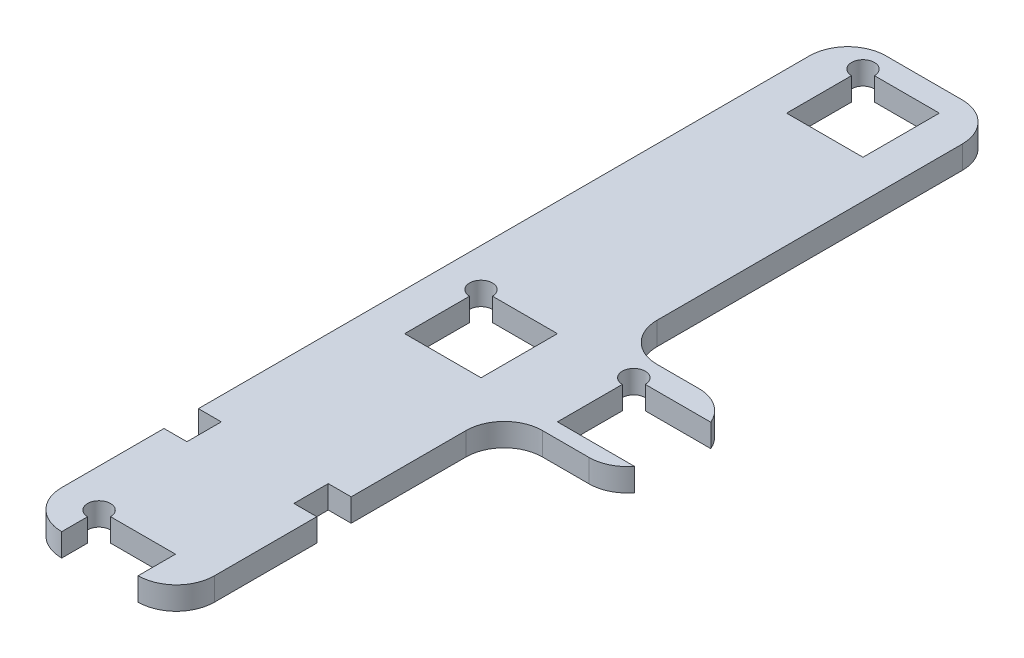
from build123d import *

# Parameters (mm, degrees)
SKETCH1_R           = 1.5
SKETCH1_W           = 20
SKETCH1_H           = 5
BOSS_EXTRUDE3_DEPTH = 3
FILLET2_R           = 5
CUT_EXTRUDE1_REACH  = 74.753
SKETCH3_W           = 28.786192162
SKETCH3_H           = 21.000620262
FILLET3_R           = 5
SKETCH5_W           = 10
SKETCH5_H           = 10
CUT_EXTRUDE2_DEPTH  = 10
BOSS_EXTRUDE5_START = -3
SKETCH8_W           = 35
SKETCH8_H           = 15
SKETCH8_R           = 1.5
BOSS_EXTRUDE5_DEPTH = 3
CUT_EXTRUDE3_REACH  = 62.523
SKETCH9_W           = 10
SKETCH9_H           = 10
SKETCH9_W_2         = 11
FILLET4_R           = 5


with BuildPart() as part:
    # Sketch1 → Boss-Extrude3 (new body)
    # profile 1 of 3: a face of its own
    with BuildSketch(Plane(origin=(0, 0, 0), x_dir=(1, 0, 0), z_dir=(0, 1, 0))):
        Polygon((10, 55), (-10, 55), (-10, -30), (-7, -30), (-7, -34.5), (-10, -34.5), (-10, -50), (10, -50), (10, -34.5), (7, -34.5), (7, -30), (10, -30), align=None)
        with Locations(Location((-5, -48, 0), (0, 0, 270))):
            Circle(SKETCH1_R, mode=Mode.SUBTRACT)
        with Locations(Location((-5, 2, 0), (0, 0, 270))):
            Circle(SKETCH1_R, mode=Mode.SUBTRACT)
        with Locations(Location((-5, 52, 0), (0, 0, 270))):
            Circle(SKETCH1_R, mode=Mode.SUBTRACT)
    # profile 2 of 3: a face of its own
    with BuildSketch(Plane(origin=(0, 0, 0), x_dir=(1, 0, 0), z_dir=(0, 1, 0))):
        Polygon((10, -55), (-10, -55), (-10, -64.5), (-7, -64.5), (-7, -69), (-10, -69), (-10, -72), (10, -72), (10, -69), (7, -69), (7, -64.5), (10, -64.5), align=None)
    # profile 3 of 3: a face of its own
    with BuildSketch(Plane(origin=(0, 0, 0), x_dir=(1, 0, 0), z_dir=(0, 1, 0))):
        with Locations((0, -52.5)):
            Rectangle(SKETCH1_W, SKETCH1_H)
    extrude(amount=BOSS_EXTRUDE3_DEPTH)

    # Fillet2
    # the kernel refuses this fillet: 5 mm, written as the material it takes off along each edge
    with BuildSketch(Plane(origin=(10, -11.456439237, 72), x_dir=(0, 0, -1), z_dir=(0, 1, 0))) as fillet2_piece_1:
        with BuildLine():
            CenterArc((5, 4.582575695), FILLET2_R, 180, 66.421821522)
            Line((0, 4.582575695), (-0.1, 4.582575695))
            Line((-0.1, 4.582575695), (-0.1, 0))
            Line((-0.1, 0), (0, -0.1))
            ThreePointArc((0, -0.1), (1.5, -0.1), (2.96, -0.091651514))
            Line((2.96, -0.091651514), (3, 0))
        make_face()
    extrude(amount=25.912878475, mode=Mode.SUBTRACT)
    with BuildSketch(Plane(origin=(-10, -11.456439237, 72), x_dir=(1, 0, 0), z_dir=(0, 1, 0))) as fillet2_piece_2:
        with BuildLine():
            CenterArc((4.582575695, 5), FILLET2_R, 203.578178478, 66.421821522)
            Line((0, 3), (-0.091651514, 2.96))
            ThreePointArc((-0.091651514, 2.96), (-0.1, 1.5), (-0.1, 0))
            Line((-0.1, 0), (0, -0.1))
            Line((0, -0.1), (4.582575695, -0.1))
            Line((4.582575695, -0.1), (4.582575695, 0))
        make_face()
    extrude(amount=25.912878475, mode=Mode.SUBTRACT)
    with BuildSketch(Plane(origin=(-10, -12.5, -55), x_dir=(0, 0, 1), z_dir=(0, 1, 0))) as fillet2_piece_3:
        with BuildLine():
            CenterArc((FILLET2_R, FILLET2_R), FILLET2_R, 180, 90)
            Line((0, FILLET2_R), (-FILLET2_R * 0.02, FILLET2_R))
            Line((-FILLET2_R * 0.02, FILLET2_R), (-FILLET2_R * 0.02, -FILLET2_R * 0.02))
            Line((-FILLET2_R * 0.02, -FILLET2_R * 0.02), (FILLET2_R, -FILLET2_R * 0.02))
            Line((FILLET2_R, -FILLET2_R * 0.02), (FILLET2_R, 0))
        make_face()
    extrude(amount=28, mode=Mode.SUBTRACT)
    with BuildSketch(Plane(origin=(10, -12.5, -55), x_dir=(0, 0, 1), z_dir=(0, 1, 0))) as fillet2_piece_4:
        with BuildLine():
            CenterArc((FILLET2_R, -FILLET2_R), FILLET2_R, 90, 90)
            Line((0, -FILLET2_R), (-FILLET2_R * 0.02, -FILLET2_R))
            Line((-FILLET2_R * 0.02, -FILLET2_R), (-FILLET2_R * 0.02, FILLET2_R * 0.02))
            Line((-FILLET2_R * 0.02, FILLET2_R * 0.02), (FILLET2_R, FILLET2_R * 0.02))
            Line((FILLET2_R, FILLET2_R * 0.02), (FILLET2_R, 0))
        make_face()
    extrude(amount=28, mode=Mode.SUBTRACT)

    # Sketch3 → Cut-Extrude1 (cut, up to next)
    with BuildSketch(Plane(origin=(0, 3, 0), x_dir=(1, 0, 0), z_dir=(0, 1, 0)), mode=Mode.PRIVATE) as cut_extrude1_sk1:
        with Locations((0, -63.390803798)):
            Rectangle(SKETCH3_W, SKETCH3_H)
    cut_extrude1_tool1 = extrude(cut_extrude1_sk1.sketch, amount=-CUT_EXTRUDE1_REACH, mode=Mode.PRIVATE) & part.part
    add(cut_extrude1_tool1.solids().sort_by_distance((0, 3, 63.390804))[0], mode=Mode.SUBTRACT)

    # Fillet3
    fillet3_edges = [part.edges().sort_by_distance(p)[0] for p in [
        (10, 1.5, 52.890493667),
        (-10, 1.5, 52.890493667),
    ]]
    fillet(fillet3_edges, radius=FILLET3_R)

    # Sketch5 → Cut-Extrude2 (cut)
    with BuildSketch(Plane(origin=(0, 3, 0), x_dir=(1, 0, 0), z_dir=(0, 1, 0))):
        with Locations((0, -53)):
            Rectangle(SKETCH5_W, SKETCH5_H)
        with Locations((0, 47)):
            Rectangle(SKETCH5_W, SKETCH5_H)
    extrude(amount=-CUT_EXTRUDE2_DEPTH, mode=Mode.SUBTRACT)

    # Sketch8 → Boss-Extrude5 (add)
    with BuildSketch(Plane(origin=(0, 3, 0), x_dir=(1, 0, 0), z_dir=(0, 1, 0)).offset(BOSS_EXTRUDE5_START)):
        with Locations((7.580003557, -2.462217959)):
            Rectangle(SKETCH8_W, SKETCH8_H)
        with Locations(Location((15, 2, 0), (0, 0, 270))):
            Circle(SKETCH8_R, mode=Mode.SUBTRACT)
        with Locations(Location((-5, 2, 0), (0, 0, 270))):
            Circle(SKETCH8_R, mode=Mode.SUBTRACT)
    extrude(amount=BOSS_EXTRUDE5_DEPTH)

    # Sketch9 → Cut-Extrude3 (cut, up to next)
    with BuildSketch(Plane(origin=(0, 3, 0), x_dir=(1, 0, 0), z_dir=(0, 1, 0)), mode=Mode.PRIVATE) as cut_extrude3_sk1:
        with Locations((0, -3)):
            Rectangle(SKETCH9_W, SKETCH9_H)
    cut_extrude3_tool1 = extrude(cut_extrude3_sk1.sketch, amount=-CUT_EXTRUDE3_REACH, mode=Mode.PRIVATE) & part.part
    # Sketch9 → Cut-Extrude3 (cut, up to next)
    with BuildSketch(Plane(origin=(0, 3, 0), x_dir=(1, 0, 0), z_dir=(0, 1, 0)), mode=Mode.PRIVATE) as cut_extrude3_sk2:
        with Locations((20.5, -3)):
            Rectangle(SKETCH9_W_2, SKETCH9_H)
    cut_extrude3_tool2 = extrude(cut_extrude3_sk2.sketch, amount=-CUT_EXTRUDE3_REACH, mode=Mode.PRIVATE) & part.part
    add(cut_extrude3_tool1.solids().sort_by_distance((0, 3, 3))[0], mode=Mode.SUBTRACT)
    add(cut_extrude3_tool2.solids().sort_by_distance((20.5, 3, 3))[0], mode=Mode.SUBTRACT)

    # Fillet4
    # the kernel refuses this fillet: 5 mm, written as the material it adds along each edge
    with BuildSketch(Plane(origin=(10, 0, 9.962217959), x_dir=(1, 0, 0), z_dir=(0, 1, 0))) as fillet4_piece_1:
        with BuildLine():
            CenterArc((FILLET4_R, -FILLET4_R), FILLET4_R, 90, 90)
            Line((0, -FILLET4_R), (0, 0))
            Line((0, 0), (FILLET4_R, 0))
        make_face()
    extrude(amount=3)
    with BuildSketch(Plane(origin=(10, 3, -5.037782041), x_dir=(0, 0, -1), z_dir=(0, -1, 0))) as fillet4_piece_2:
        with BuildLine():
            CenterArc((FILLET4_R, FILLET4_R), FILLET4_R, 180, 90)
            Line((0, FILLET4_R), (0, 0))
            Line((0, 0), (FILLET4_R, 0))
        make_face()
    extrude(amount=3)
    # the kernel refuses this fillet: 5 mm, written as the material it takes off along each edge
    with BuildSketch(Plane(origin=(25.080003557, -9.928456662, 9.962217959), x_dir=(0, 0, -1), z_dir=(0, 1, 0))) as fillet4_2_piece_1:
        with BuildLine():
            CenterArc((5, 3.971382665), FILLET4_R, 180, 52.586975679)
            Line((0, 3.971382665), (0, 0))
            Line((0, 0), (1.962217959, 0))
        make_face()
    extrude(amount=22.856913325, mode=Mode.SUBTRACT)
    with BuildSketch(Plane(origin=(25.080003557, -11.497200931, -5.037782041), x_dir=(-1, 0, 0), z_dir=(0, 1, 0))) as fillet4_2_piece_2:
        with BuildLine():
            CenterArc((4.598880373, 5), FILLET4_R, 203.106632515, 66.893367485)
            Line((0, 3.037782041), (0, 0))
            Line((0, 0), (4.598880373, 0))
        make_face()
    extrude(amount=25.994401863, mode=Mode.SUBTRACT)


solid = part.part
